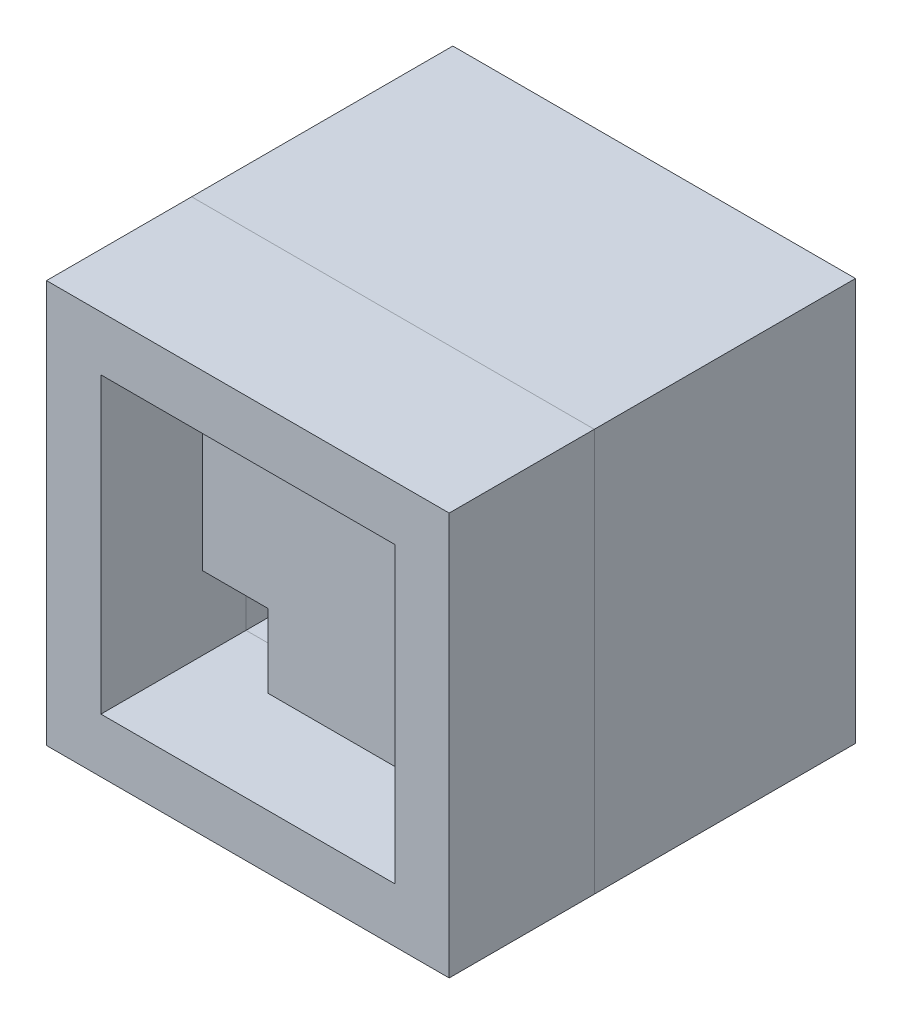
from build123d import *

# Parameters (mm, degrees)
SKETCH1_W           = 11.1
SKETCH1_H           = 11.1
BOSS_EXTRUDE1_DEPTH = 1.2
BOSS_EXTRUDE2_START = 1.2
SKETCH1_3_W         = 11.1
SKETCH1_3_H         = 11.1
SKETCH1_3_W_2       = 8.1
SKETCH1_3_H_2       = 8.1
BOSS_EXTRUDE2_DEPTH = 10
BOSS_EXTRUDE3_START = 8.4
SKETCH1_4_W         = 11.1
SKETCH1_4_H         = 11.1
SKETCH1_4_W_2       = 8.1
SKETCH1_4_H_2       = 8.1
BOSS_EXTRUDE3_DEPTH = 1.2
SKETCH2_W           = 4.05
SKETCH2_H           = 1.5
CUT_EXTRUDE1_DEPTH  = 4


# Read off the part's stored shape, not the designer's step: Split2
with BuildPart() as part:
    # Sketch1 → Boss-Extrude1 (new body)
    with BuildSketch(Plane.XY):
        with Locations((5.55, 5.55)):
            Rectangle(SKETCH1_W, SKETCH1_H)
    extrude(amount=BOSS_EXTRUDE1_DEPTH)

    # Sketch1<3> → Boss-Extrude2 (add)
    with BuildSketch(Plane.XY.offset(BOSS_EXTRUDE2_START)):
        with Locations((5.55, 5.55)):
            Rectangle(SKETCH1_3_W, SKETCH1_3_H)
        with Locations((5.55, 5.55)):
            Rectangle(SKETCH1_3_W_2, SKETCH1_3_H_2, mode=Mode.SUBTRACT)
    extrude(amount=BOSS_EXTRUDE2_DEPTH)

    # Sketch1<4> → Boss-Extrude3 (add)
    # profile 1 of 2: a face of its own
    with BuildSketch(Plane.XY.offset(BOSS_EXTRUDE3_START)):
        with Locations((5.55, 5.55)):
            Rectangle(SKETCH1_4_W, SKETCH1_4_H)
        with Locations((5.55, 5.55)):
            Rectangle(SKETCH1_4_W_2, SKETCH1_4_H_2, mode=Mode.SUBTRACT)
    # profile 2 of 2: a face of its own
    with BuildSketch(Plane.XY.offset(BOSS_EXTRUDE3_START)):
        Polygon((3.3, 3.525), (3.3, 1.5), (7.8, 1.5), (7.8, 3.525), (9.6, 3.525), (9.6, 7.575), (7.8, 7.575), (7.8, 9.6), (3.3, 9.6), (3.3, 7.575), (1.5, 7.575), (1.5, 3.525), align=None)
    extrude(amount=-BOSS_EXTRUDE3_DEPTH)


with BuildPart() as body_2:
    # Split2: the piece on the far side of the plane
    add(part.part)
    split(bisect_by=Plane.XY.offset(7.2), keep=Keep.BOTTOM)

    # Sketch2 → Cut-Extrude1 (cut)
    with BuildSketch(Plane.XY.offset(1.2)):
        with Locations((5.55, 0.75)):
            Rectangle(SKETCH2_W, SKETCH2_H)
    extrude(amount=CUT_EXTRUDE1_DEPTH, mode=Mode.SUBTRACT)


with BuildPart() as part_1:
    add(part.part)

    # Split2
    split(bisect_by=Plane.XY.offset(7.2), keep=Keep.TOP)


solid = Compound([body_2.part, part_1.part])
